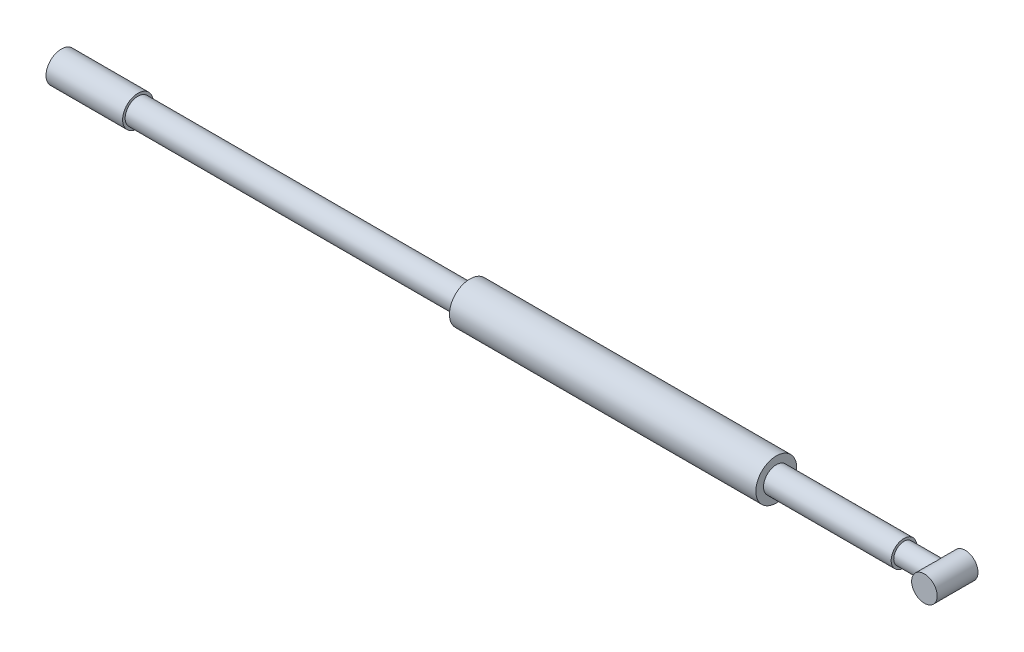
from build123d import *

# Parameters (mm, degrees)
SKETCH1_R                = 2.5
BOSS_EXTRUDE1_DEPTH      = 150
SKETCH3_R                = 3
BOSS_EXTRUDE2_DEPTH      = 15
SKETCH4_R                = 2
BOSS_EXTRUDE3_DEPTH      = 8
BOSS_EXTRUDE4_DEPTH      = 4
BOSS_EXTRUDE4_DEPTH_BACK = 4
SKETCH5_R                = 2.5
F_3DSKETCH1_R            = 4
BOSS_EXTRUDE5_DEPTH      = 60


with BuildPart() as part:
    # Sketch1 → Boss-Extrude1 (new body)
    with BuildSketch(Plane(origin=(0, 0, 0), x_dir=(0, 0, -1), z_dir=(1, 0, 0))):
        Circle(SKETCH1_R)
    extrude(amount=BOSS_EXTRUDE1_DEPTH)

    # Sketch3 → Boss-Extrude2 (add)
    with BuildSketch(Plane.ZY):
        Circle(SKETCH3_R)
    extrude(amount=BOSS_EXTRUDE2_DEPTH)

    # Sketch4 → Boss-Extrude3 (add)
    with BuildSketch(Plane(origin=(150, 0, 0), x_dir=(0, 0, -1), z_dir=(1, 0, 0))):
        Circle(SKETCH4_R)
    extrude(amount=BOSS_EXTRUDE3_DEPTH)

    # Sketch5 → Boss-Extrude4 (add, two sides: drawn at the far end of the back side and taken through both)
    with BuildSketch(Plane.XY.offset(-BOSS_EXTRUDE4_DEPTH_BACK)):
        with Locations((158, 0)):
            Circle(SKETCH5_R)
    extrude(amount=BOSS_EXTRUDE4_DEPTH + BOSS_EXTRUDE4_DEPTH_BACK)

    # 3DSketch1 → Boss-Extrude5 (add)
    with BuildSketch(Plane(origin=(65, 0, 0), x_dir=(0, 0, 1), z_dir=(1, 0, 0))):
        Circle(F_3DSKETCH1_R)
    extrude(amount=BOSS_EXTRUDE5_DEPTH)


solid = part.part
